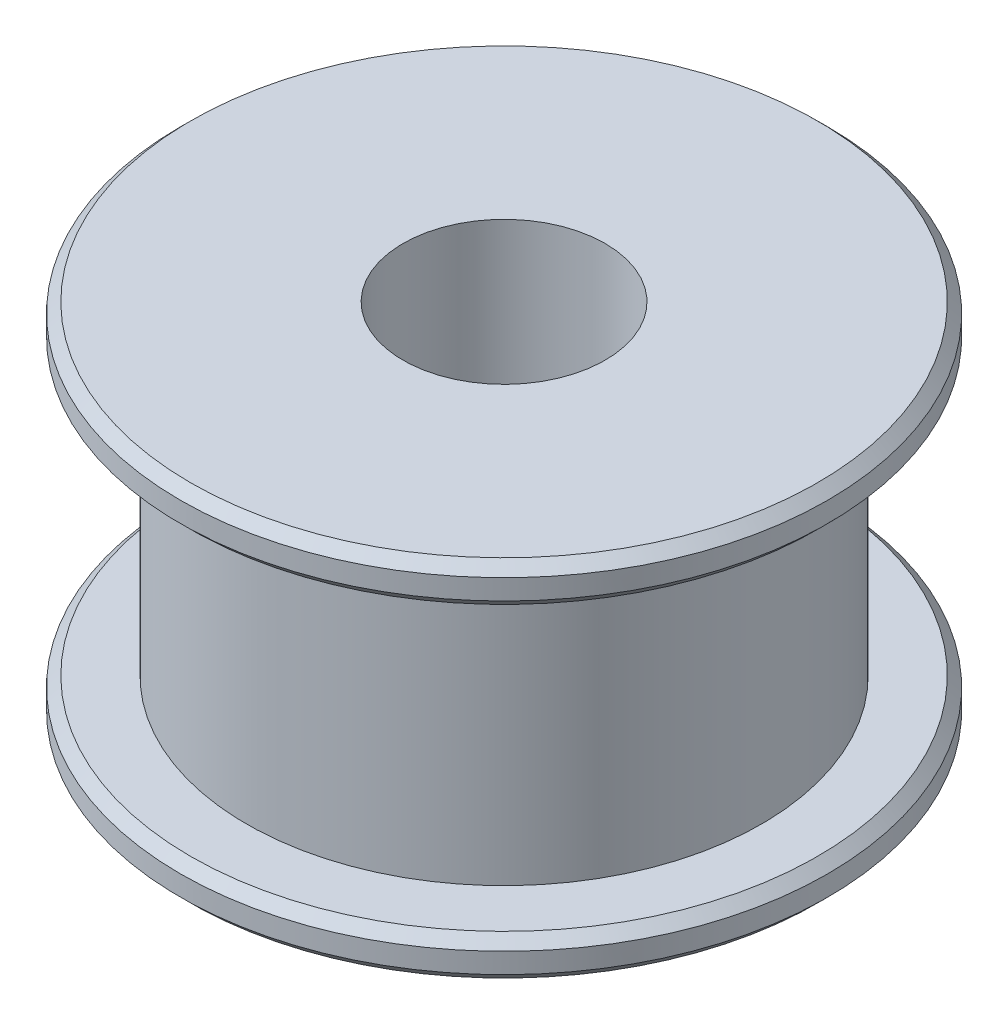
from build123d import *

# Parameters (mm, degrees)
CHAMFER1_SIZE = 0.25


with BuildPart() as part:
    # Sketch4 → Revolve2 (revolve)
    with BuildSketch(Plane.XY):
        Polygon((2.5, 0), (8, 0), (8, 1), (6.366197724, 1), (6.366197724, 8), (8, 8), (8, 9), (2.5, 9), align=None)
    revolve(axis=Axis((0, 0, 0), (0, 1, 0)))

    # Chamfer1
    chamfer1_edges = [part.edges().sort_by_distance(p)[0] for p in [
        (-8, 0, 0),
        (-8, 1, 0),
        (-8, 8, 0),
        (-8, 9, 0),
    ]]
    chamfer(chamfer1_edges, length=CHAMFER1_SIZE)


solid = part.part
